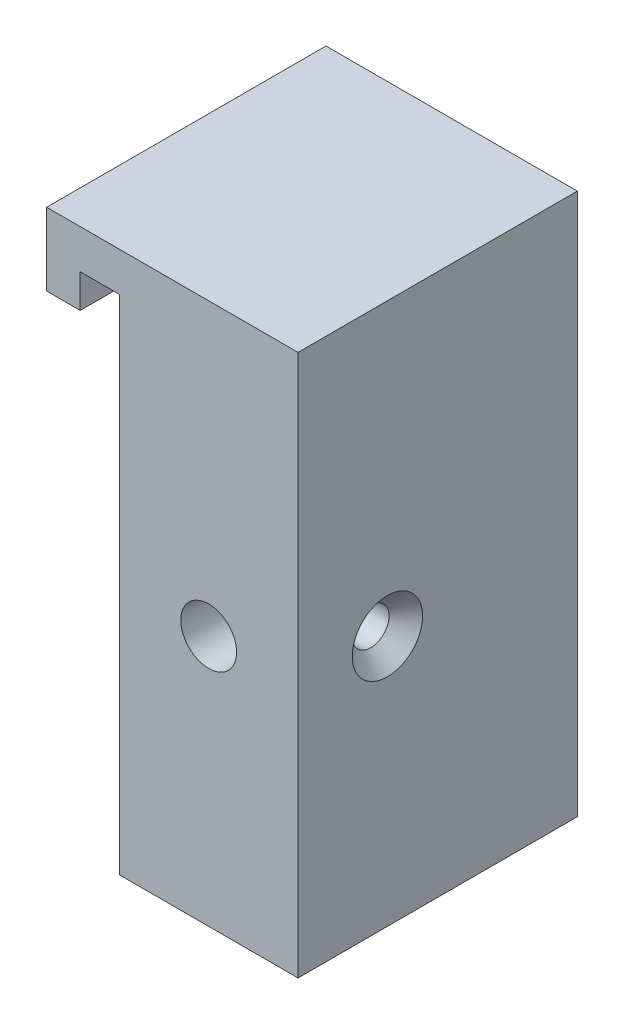
from build123d import *

# Parameters (mm, degrees)
BOSS_EXTRUDE1_DEPTH       = 25
F_1_0MM_DOWEL_HOLE1_D     = 10
F_1_0MM_DOWEL_HOLE1_DEPTH = 25
M8X1_0_TAPPED_HOLE1_D     = 7
M8X1_0_TAPPED_HOLE1_DEPTH = 15


# Read off the part's stored shape, not the designer's step: CSK for M6 Flat Head Machine Screw1
with BuildPart() as part:
    # Sketch1 → Boss-Extrude1 (new, symmetric)
    with BuildSketch(Plane.XY):
        Polygon((0, 0), (0, 97), (-45, 97), (-45, 84), (-39, 84), (-39, 90), (-32, 90), (-32, 0), align=None)
    extrude(amount=BOSS_EXTRUDE1_DEPTH, both=True)

    # Ø1.0mm Dowel Hole1
    with Locations(Plane.XY.offset(25)):
        with Locations((-16, 45)):
            Hole(F_1_0MM_DOWEL_HOLE1_D / 2, depth=F_1_0MM_DOWEL_HOLE1_DEPTH)

    # M8x1.0 Tapped Hole1
    with Locations(Plane(origin=(0, 0, 0), x_dir=(-1, 0, 0), z_dir=(0, -1, 0))):
        with Locations((7, 0), (25, 0)):
            Hole(M8X1_0_TAPPED_HOLE1_D / 2, depth=M8X1_0_TAPPED_HOLE1_DEPTH)

    # CSK for M6 Flat Head Machine Screw1 outl → CSK for M6 Flat Head Machine Screw1 (revolve, cut)
    with BuildSketch(Plane(origin=(0, 45, 9), x_dir=(0, 1, 0), z_dir=(0, 0, -1))):
        Polygon((0, -12.244302381), (3.3, -12.244302381), (3.3, -3), (6.3, 0), (0, 0), align=None)
    revolve(axis=Axis((0, 45, 9), (1, 0, 0)), mode=Mode.SUBTRACT)


solid = part.part
